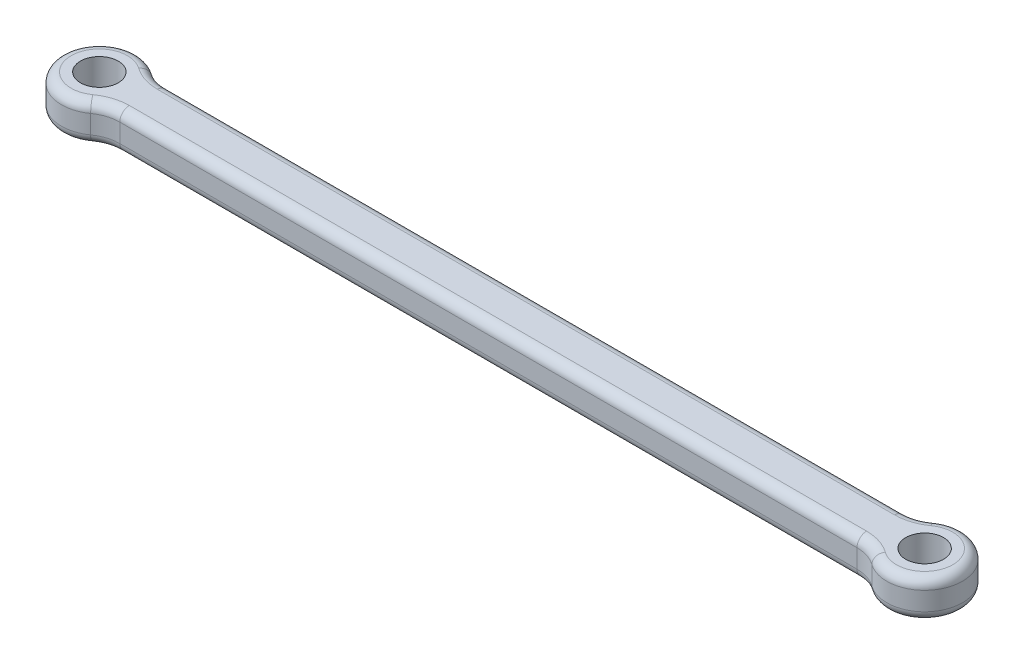
from build123d import *

# Parameters (mm, degrees)
SKETCH1_R           = 5
BOSS_EXTRUDE1_DEPTH = 10
FILLET1_R           = 2.54
SCALE1_SCALE        = 0.66


with BuildPart() as part:
    # Sketch1 → Boss-Extrude1 (new body)
    with BuildSketch(Plane(origin=(0, 0, 0), x_dir=(1, 0, 0), z_dir=(0, 1, 0))):
        with BuildLine():
            Line((-42.950776184, -6.25), (152.170776184, -6.25))
            ThreePointArc((152.170776184, -6.25), (155.232638362, -6.730283618), (158.000388092, -8.125))
            ThreePointArc((158.000388092, -8.125), (173.83, 0), (158.000388092, 8.125))
            ThreePointArc((158.000388092, 8.125), (155.232638362, 6.730283618), (152.170776184, 6.25))
            Line((152.170776184, 6.25), (-42.950776184, 6.25))
            ThreePointArc((-42.950776184, 6.25), (-46.012638362, 6.730283618), (-48.780388092, 8.125))
            ThreePointArc((-48.780388092, 8.125), (-64.61, 0), (-48.780388092, -8.125))
            ThreePointArc((-48.780388092, -8.125), (-46.012638362, -6.730283618), (-42.950776184, -6.25))
        make_face()
        with Locations((-54.61, 0)):
            Circle(SKETCH1_R, mode=Mode.SUBTRACT)
        with Locations((163.83, 0)):
            Circle(SKETCH1_R, mode=Mode.SUBTRACT)
    extrude(amount=BOSS_EXTRUDE1_DEPTH)

    # Fillet1
    fillet1_edges = [part.edges().sort_by_distance(p)[0] for p in [
        (-64.61, 0, 0),
        (-46.012638362, 0, 6.730283618),
        (54.61, 0, 6.25),
        (155.232638362, 0, 6.730283618),
        (173.83, 0, 0),
        (155.232638362, 0, -6.730283618),
        (54.61, 0, -6.25),
        (-46.012638362, 0, -6.730283618),
        (54.61, 10, -6.25),
        (155.232638362, 10, -6.730283618),
        (173.83, 10, 0),
        (155.232638362, 10, 6.730283618),
        (54.61, 10, 6.25),
        (-46.012638362, 10, 6.730283618),
        (-64.61, 10, 0),
        (-46.012638362, 10, -6.730283618),
    ]]
    fillet(fillet1_edges, radius=FILLET1_R)


with BuildPart() as part_1:
    # Scale1: scaled about (54.61, 5, 0)
    add(part.part.scale(SCALE1_SCALE).moved(Location((18.5674, 1.7, 0))))


solid = part_1.part
